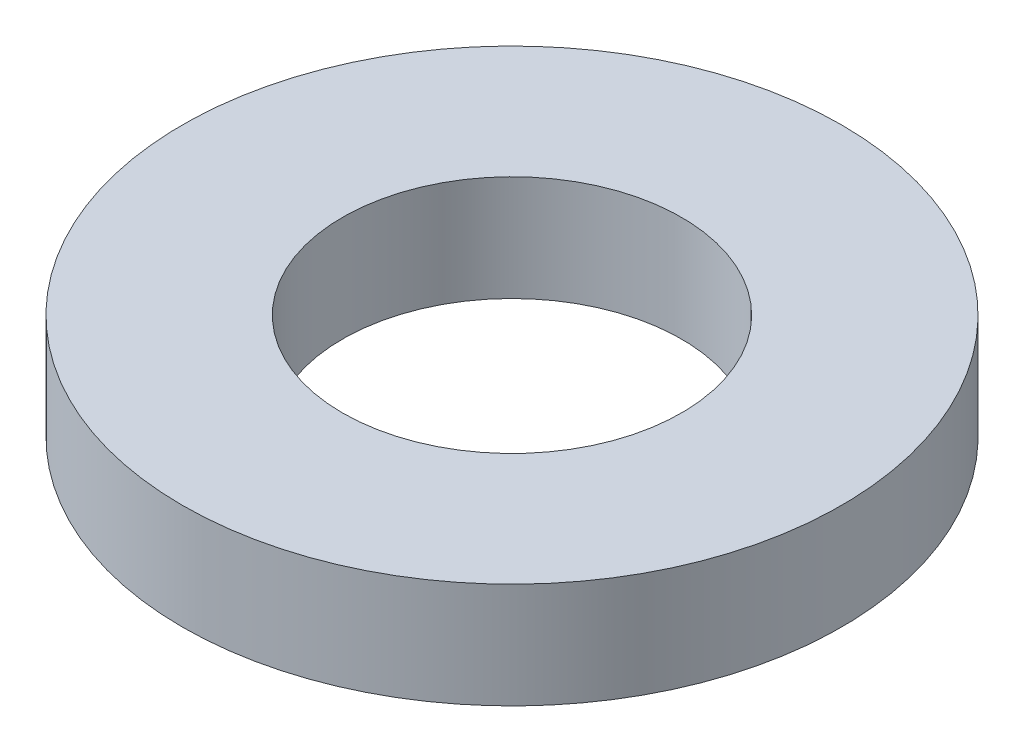
from build123d import *

# Parameters (mm, degrees)
SKETCH1_R           = 87.5
BOSS_EXTRUDE1_DEPTH = 28
SKETCH2_R           = 45
CUT_EXTRUDE1_DEPTH  = 127.871982723


with BuildPart() as part:
    # Sketch1 → Boss-Extrude1 (new body)
    with BuildSketch(Plane(origin=(0, 0, 0), x_dir=(1, 0, 0), z_dir=(0, 1, 0))):
        Circle(SKETCH1_R)
    extrude(amount=BOSS_EXTRUDE1_DEPTH)

    # Sketch2 → Cut-Extrude1 (cut, through all)
    with BuildSketch(Plane(origin=(0, 0, 0), x_dir=(1, 0, 0), z_dir=(0, 1, 0))):
        Circle(SKETCH2_R)
    extrude(amount=CUT_EXTRUDE1_DEPTH, mode=Mode.SUBTRACT)


solid = part.part
